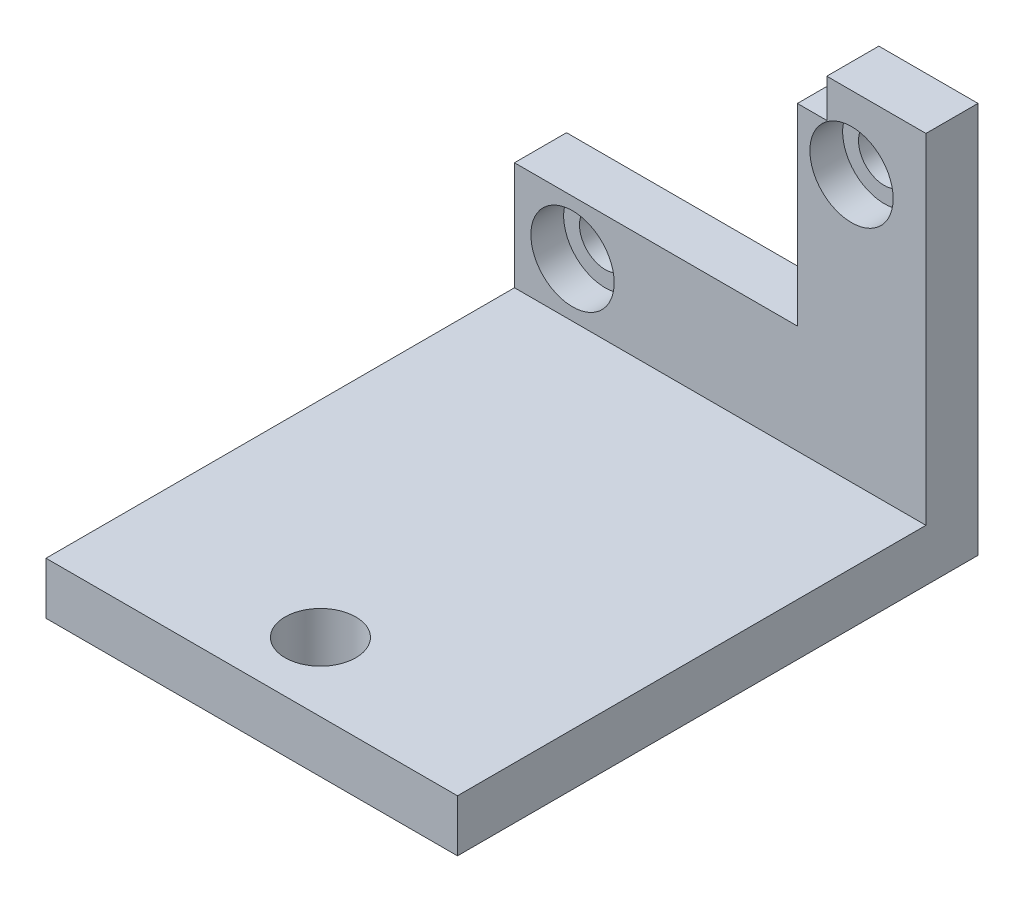
from build123d import *

# Parameters (mm, degrees)
SKETCH2_R           = 1.5748
BOSS_EXTRUDE1_DEPTH = 3.175
SKETCH3_W           = 25.098
SKETCH3_H           = 3.175
BOSS_EXTRUDE3_DEPTH = 31.75
SKETCH4_R           = 2.159
CUT_EXTRUDE1_DEPTH  = 42.7555469
SKETCH5_R           = 2.54
CUT_EXTRUDE2_DEPTH  = 2


with BuildPart() as part:
    # Sketch2 → Boss-Extrude1 (new body)
    with BuildSketch(Plane.XY):
        Polygon((4.395213829, 10.321811953), (4.395213829, -1.438404904), (-12.860786171, -1.438404904), (-12.860786171, -8.042404904), (12.237213829, -8.042404904), (12.237213829, 12.658595096), (6.188170382, 12.658595096), (6.188170382, 10.321811953), align=None)
        with Locations((-9.320786171, -4.740404904)):
            Circle(SKETCH2_R, mode=Mode.SUBTRACT)
        with Locations((7.697213829, 8.213595096)):
            Circle(SKETCH2_R, mode=Mode.SUBTRACT)
    extrude(amount=BOSS_EXTRUDE1_DEPTH)

    # Sketch3 → Boss-Extrude3 (add)
    with BuildSketch(Plane(origin=(0, 0, 0), x_dir=(-1, 0, 0), z_dir=(0, 0, -1))):
        with Locations((0.311786171, -9.629904904)):
            Rectangle(SKETCH3_W, SKETCH3_H)
    extrude(amount=-BOSS_EXTRUDE3_DEPTH)

    # Sketch4 → Cut-Extrude1 (cut, through all)
    with BuildSketch(Plane.XZ.offset(11.217404904)):
        with Locations((-0.311786171, 27.559)):
            Circle(SKETCH4_R)
    extrude(amount=-CUT_EXTRUDE1_DEPTH, mode=Mode.SUBTRACT)

    # Sketch5 → Cut-Extrude2 (cut)
    with BuildSketch(Plane.XY.offset(3.175)):
        with Locations((7.697213829, 8.213595096)):
            Circle(SKETCH5_R)
        with Locations((-9.320786171, -4.740404904)):
            Circle(SKETCH5_R)
    extrude(amount=-CUT_EXTRUDE2_DEPTH, mode=Mode.SUBTRACT)


solid = part.part
